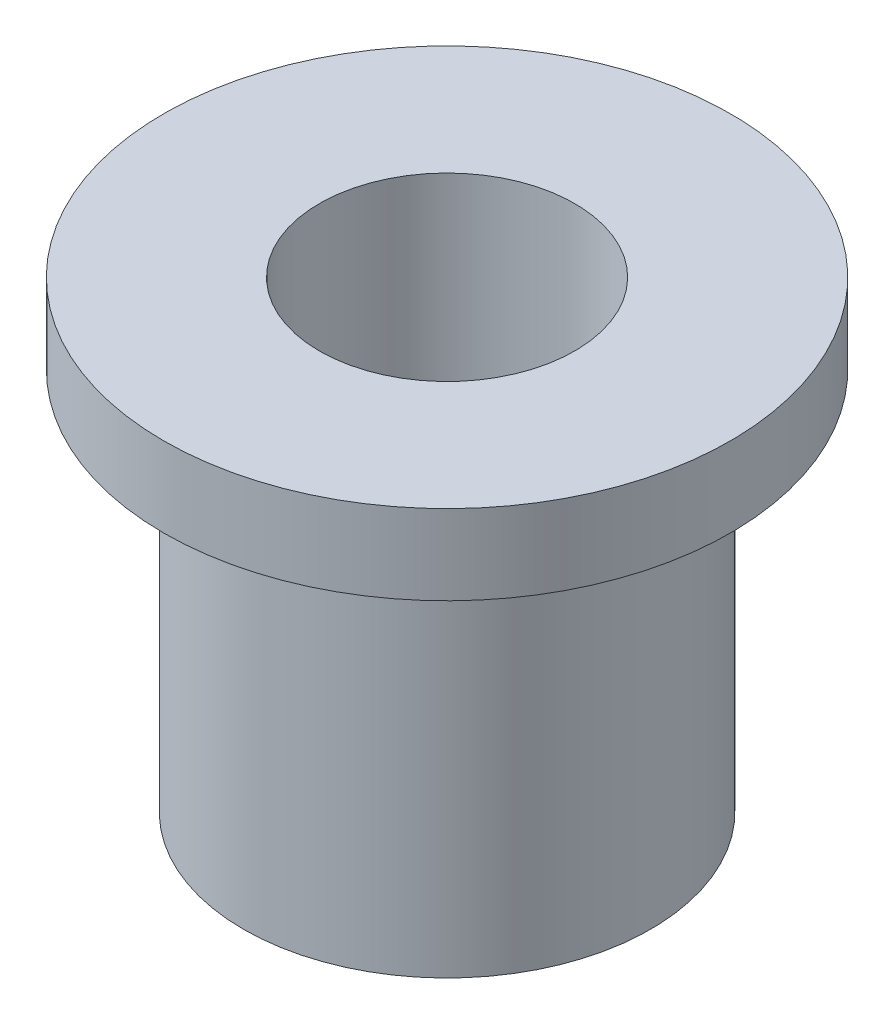
from build123d import *

# Parameters (mm, degrees)
SKETCH1_R           = 2.55
SKETCH1_R_2         = 1.6
BOSS_EXTRUDE1_DEPTH = 5.8
BOSS_EXTRUDE2_START = -1
SKETCH2_R           = 3.55
SKETCH2_R_2         = 1.6
BOSS_EXTRUDE2_DEPTH = 1


with BuildPart() as part:
    # Sketch1 → Boss-Extrude1 (new body)
    with BuildSketch(Plane(origin=(0, 0, 0), x_dir=(1, 0, 0), z_dir=(0, 1, 0))):
        Circle(SKETCH1_R)
        Circle(SKETCH1_R_2, mode=Mode.SUBTRACT)
    extrude(amount=BOSS_EXTRUDE1_DEPTH)

    # Sketch2 → Boss-Extrude2 (add)
    with BuildSketch(Plane(origin=(0, 5.8, 0), x_dir=(1, 0, 0), z_dir=(0, 1, 0)).offset(BOSS_EXTRUDE2_START)):
        Circle(SKETCH2_R)
        Circle(SKETCH2_R_2, mode=Mode.SUBTRACT)
    extrude(amount=BOSS_EXTRUDE2_DEPTH)


solid = part.part
